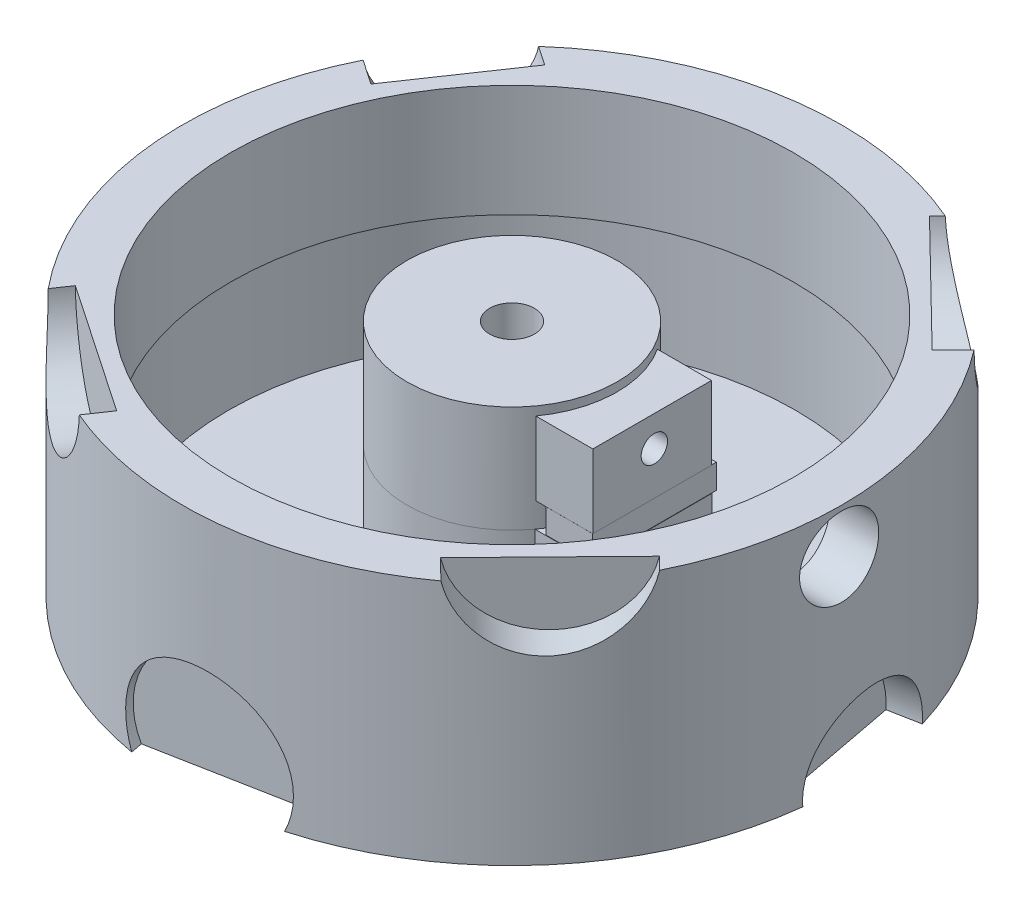
from build123d import *

# Parameters (mm, degrees)
SKETCH1_R                      = 15.958
SHAFTHOLDERNEARMOTOR_DEPTH     = 17.19
SKETCH2_R                      = 3.4
CUT_EXTRUDE1_DEPTH             = 16.85
SKETCH5_W                      = 1.550685087
SKETCH5_H                      = 7.184215806
BOSS_EXTRUDE2_DEPTH            = 13.55
SKETCH7_W                      = 18.003976239
SKETCH7_H                      = 11.144937805
BOSS_EXTRUDE3_DEPTH            = 19
CUT_EXTRUDE2_DEPTH             = 1
CUT_EXTRUDE2_DEPTH_BACK        = 19
SKETCH6_R                      = 2
NUTOPENING_DEPTH               = 5.31
NUTOPENING_DEPTH_BACK          = 30
SKETCH9_W                      = 4.114607917
SKETCH9_H                      = 9.493348351
SKETCH10_R                     = 50
BOSS_EXTRUDE4_DEPTH            = 20
SKETCH12_R                     = 43
SKETCH12_R_2                   = 15.95790089
CUTTOREMVEEXCESSMATERIAL_DEPTH = 17
BOSS_EXTRUDE5_START            = 17
SKETCH13_R                     = 50
SKETCH13_R_2                   = 42.696683681
BOSS_EXTRUDE5_DEPTH            = 17
CUT_EXTRUDE6_DEPTH             = 4.114607916
SKETCH16_R                     = 6
CUT_EXTRUDE7_DEPTH             = 40
SKETCH19_R                     = 12
CUT_EXTRUDE8_DEPTH             = 5
SKETCH20_R                     = 12
CUT_EXTRUDE9_DEPTH             = 5
SKETCH22_R                     = 12.553525499
CUT_EXTRUDE10_DEPTH            = 5
SKETCH21_R                     = 10
CUT_EXTRUDE11_DEPTH            = 5
SKETCH23_R                     = 11.965333231
CUT_EXTRUDE12_DEPTH            = 5
SKETCH25_R                     = 9.629681042
CUT_EXTRUDE13_DEPTH            = 5
SKETCH26_R                     = 15.012411299
CUT_EXTRUDE14_DEPTH            = 5
SKETCH27_R                     = 11.854712092
CUT_EXTRUDE15_DEPTH            = 5
SKETCH28_W                     = 8.838679887
SKETCH28_H                     = 18.172415452
BOSS_EXTRUDE6_DEPTH            = 17
SKETCH29_W                     = 7.025540803
SKETCH29_H                     = 18.786067296
BOSS_EXTRUDE7_DEPTH            = 3.722722351
SKETCH31_R                     = 26.336547497
CUT_EXTRUDE16_DEPTH            = 1
SKETCH32_R                     = 3.380332453
CUT_EXTRUDE17_DEPTH            = 2


with BuildPart() as part:
    # Sketch1 → ShaftHolderNearMotor (new body)
    with BuildSketch(Plane(origin=(0, 0, 0), x_dir=(1, 0, 0), z_dir=(0, 1, 0))):
        with Locations(Location((0, 0, 0), (0, 0, 270))):
            Circle(SKETCH1_R)
    extrude(amount=SHAFTHOLDERNEARMOTOR_DEPTH)

    # Sketch2 → Cut-Extrude1 (cut)
    with BuildSketch(Plane(origin=(0, 17.19, 0), x_dir=(1, 0, 0), z_dir=(0, 1, 0))):
        with Locations(Location((0, 0, 0), (0, 0, 270))):
            Circle(SKETCH2_R)
    extrude(amount=-CUT_EXTRUDE1_DEPTH, mode=Mode.SUBTRACT)

    # Sketch5 → Boss-Extrude2 (add)
    with BuildSketch(Plane(origin=(0, 12.15, 0), x_dir=(1, 0, 0), z_dir=(0, 1, 0))):
        with Locations((3.375342544, 0.020519704)):
            Rectangle(SKETCH5_W, SKETCH5_H)
    extrude(amount=-BOSS_EXTRUDE2_DEPTH)

    # Sketch7 → Boss-Extrude3 (add)
    with BuildSketch(Plane.ZY.offset(-2.6)):
        with Locations((0.33027221, 9.295191254)):
            Rectangle(SKETCH7_W, SKETCH7_H)
    extrude(amount=-BOSS_EXTRUDE3_DEPTH)

    # Sketch6 → Cut-Extrude2 (cut, two sides: drawn at the far end of the back side and taken through both)
    with BuildSketch(Plane.ZY.offset(-2.6).offset(-CUT_EXTRUDE2_DEPTH_BACK)):
        with Locations((0, 10.236925537)):
            Circle(SKETCH6_R)
    extrude(amount=CUT_EXTRUDE2_DEPTH + CUT_EXTRUDE2_DEPTH_BACK, mode=Mode.SUBTRACT)

    # Sketch9 → NutOpening (cut, two sides: drawn at the far end of the back side and taken through both)
    with BuildSketch(Plane.XY.offset(-NUTOPENING_DEPTH_BACK)):
        with Locations((6.709332625, 10.235526917)):
            Rectangle(SKETCH9_W, SKETCH9_H)
    extrude(amount=NUTOPENING_DEPTH + NUTOPENING_DEPTH_BACK, mode=Mode.SUBTRACT)

    # Sketch10 → Boss-Extrude4 (add)
    with BuildSketch(Plane.XZ):
        with Locations(Location((0, 0, 0), (0, 0, 270))):
            Circle(SKETCH10_R)
    extrude(amount=BOSS_EXTRUDE4_DEPTH)

    # Sketch12 → CutToRemveExcessMaterial (cut)
    with BuildSketch(Plane(origin=(0, 0, 0), x_dir=(1, 0, 0), z_dir=(0, 1, 0))):
        with Locations(Location((0, 0, 0), (0, 0, 270))):
            Circle(SKETCH12_R)
        with Locations(Location((0, 0, 0), (0, 0, 270))):
            Circle(SKETCH12_R_2, mode=Mode.SUBTRACT)
    extrude(amount=-CUTTOREMVEEXCESSMATERIAL_DEPTH, mode=Mode.SUBTRACT)

    # Sketch13 → Boss-Extrude5 (add)
    with BuildSketch(Plane(origin=(0, 0, 0), x_dir=(1, 0, 0), z_dir=(0, 1, 0)).offset(BOSS_EXTRUDE5_START)):
        with Locations(Location((0, 0, 0), (0, 0, 270))):
            Circle(SKETCH13_R)
        with Locations(Location((0, 0, 0), (0, 0, 270))):
            Circle(SKETCH13_R_2, mode=Mode.SUBTRACT)
    extrude(amount=-BOSS_EXTRUDE5_DEPTH)

    # Sketch14 → Cut-Extrude6 (cut)
    with BuildSketch(Plane.ZY.offset(-8.766636583)):
        Polygon((-5.45412426, 10.236925537), (-2.72706213, 5.513515372), (2.72706213, 5.513515372), (5.45412426, 10.236925537), (2.72706213, 14.960335701), (-2.72706213, 14.960335701), align=None)
    extrude(amount=CUT_EXTRUDE6_DEPTH, mode=Mode.SUBTRACT)

    # Sketch16 → Cut-Extrude7 (cut)
    with BuildSketch(Plane(origin=(21.6, 0, 0), x_dir=(0, 0, -1), z_dir=(1, 0, 0))):
        with Locations(Location((0, 10.236925537, 0), (0, 0, 180))):
            Circle(SKETCH16_R)
    extrude(amount=CUT_EXTRUDE7_DEPTH, mode=Mode.SUBTRACT)

    # Sketch19 → Cut-Extrude8 (cut)
    with BuildSketch(Plane(origin=(9.351145186, 0, 49.117777675), x_dir=(0.9823555534957298, 0, -0.18702290372063646), z_dir=(0.18702290372063649, 0, 0.9823555534957299))):
        with Locations((-6.553798813, -15.044376388)):
            Circle(SKETCH19_R)
    extrude(amount=-CUT_EXTRUDE8_DEPTH, mode=Mode.SUBTRACT)

    # Sketch20 → Cut-Extrude9 (cut)
    with BuildSketch(Plane(origin=(35.756785301, 0, 34.949281894), x_dir=(0.6989856378867483, 0, -0.7151357060223296), z_dir=(0.7151357060223296, 0, 0.6989856378867483))):
        with Locations((3.558365894, 19.429208609)):
            Circle(SKETCH20_R)
    extrude(amount=-CUT_EXTRUDE9_DEPTH, mode=Mode.SUBTRACT)

    # Sketch22 → Cut-Extrude10 (cut)
    with BuildSketch(Plane(origin=(34.949281894, 0, -35.756785301), x_dir=(-0.7151357060223288, 0, -0.698985637886749), z_dir=(0.698985637886749, 0, -0.7151357060223288))):
        with Locations((5.427738333, 18.490794011)):
            Circle(SKETCH22_R)
    extrude(amount=-CUT_EXTRUDE10_DEPTH, mode=Mode.SUBTRACT)

    # Sketch21 → Cut-Extrude11 (cut)
    with BuildSketch(Plane(origin=(49.117777675, 0, -9.351145186), x_dir=(-0.18702290372063798, 0, -0.9823555534957294), z_dir=(0.9823555534957294, 0, -0.18702290372063798))):
        with Locations((-4.791175632, -19.221882877)):
            Circle(SKETCH21_R)
    extrude(amount=-CUT_EXTRUDE11_DEPTH, mode=Mode.SUBTRACT)

    # Sketch23 → Cut-Extrude12 (cut)
    with BuildSketch(Plane(origin=(-0.570991135, 0, -49.996739585), x_dir=(-0.9999347916987428, 0, 0.011419822695298289), z_dir=(-0.011419822695298287, 0, -0.9999347916987427))):
        with Locations((4.525183767, -20.017770037)):
            Circle(SKETCH23_R)
    extrude(amount=-CUT_EXTRUDE12_DEPTH, mode=Mode.SUBTRACT)

    # Sketch25 → Cut-Extrude13 (cut)
    with BuildSketch(Plane(origin=(-41.343771844, 0, -28.119255498), x_dir=(-0.5623851099550343, 0, 0.8268754368711554), z_dir=(-0.8268754368711554, 0, -0.5623851099550343))):
        with Locations((-2.649823638, 18.643158668)):
            Circle(SKETCH25_R)
    extrude(amount=-CUT_EXTRUDE13_DEPTH, mode=Mode.SUBTRACT)

    # Sketch26 → Cut-Extrude14 (cut)
    with BuildSketch(Plane(origin=(-49.117777675, 0, 9.351145186), x_dir=(0.18702290372063635, 0, 0.9823555534957298), z_dir=(-0.9823555534957298, 0, 0.18702290372063635))):
        with Locations((-4.497650602, -19.126376963)):
            Circle(SKETCH26_R)
    extrude(amount=-CUT_EXTRUDE14_DEPTH, mode=Mode.SUBTRACT)

    # Sketch27 → Cut-Extrude15 (cut)
    with BuildSketch(Plane(origin=(-28.119255498, 0, 41.343771844), x_dir=(0.8268754368711555, 0, 0.562385109955034), z_dir=(-0.562385109955034, 0, 0.8268754368711555))):
        with Locations((-2.287517393, 17.62218093)):
            Circle(SKETCH27_R)
    extrude(amount=-CUT_EXTRUDE15_DEPTH, mode=Mode.SUBTRACT)

    # Sketch28 → Boss-Extrude6 (add)
    with BuildSketch(Plane.XZ):
        with Locations((17.180660057, 0.317955018)):
            Rectangle(SKETCH28_W, SKETCH28_H)
    extrude(amount=BOSS_EXTRUDE6_DEPTH)

    # Sketch29 → Boss-Extrude7 (add)
    with BuildSketch(Plane.XZ.offset(-3.722722351)):
        with Locations((18.03590553, -0.055280695)):
            Rectangle(SKETCH29_W, SKETCH29_H)
    extrude(amount=BOSS_EXTRUDE7_DEPTH)

    # Sketch31 → Cut-Extrude16 (cut)
    with BuildSketch(Plane(origin=(0, 17.19, 0), x_dir=(1, 0, 0), z_dir=(0, 1, 0))):
        Circle(SKETCH31_R)
    extrude(amount=-CUT_EXTRUDE16_DEPTH, mode=Mode.SUBTRACT)

    # Sketch32 → Cut-Extrude17 (cut)
    with BuildSketch(Plane(origin=(0, 14.867660156, 0), x_dir=(1, 0, 0), z_dir=(0, 1, 0))):
        Circle(SKETCH32_R)
    extrude(amount=-CUT_EXTRUDE17_DEPTH, mode=Mode.SUBTRACT)


solid = part.part
